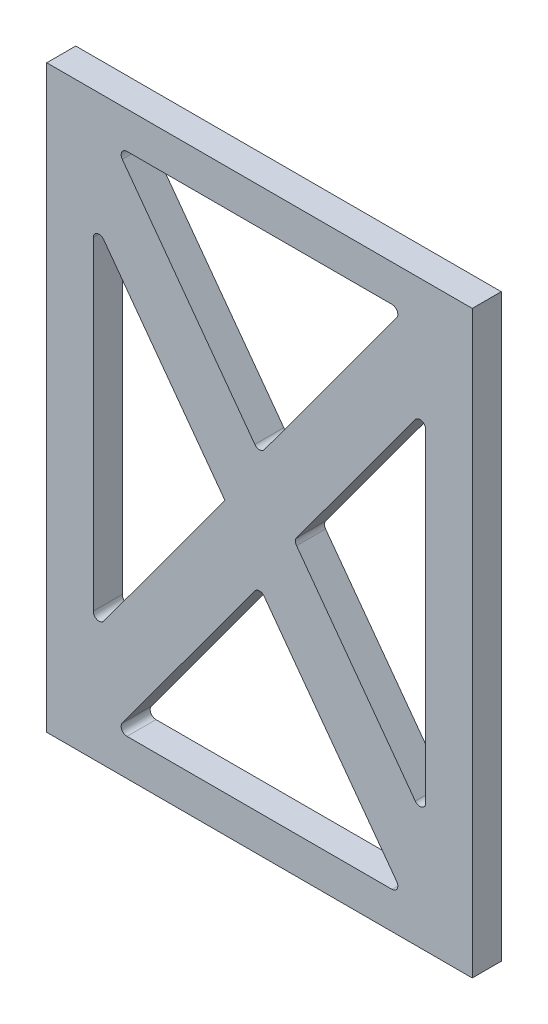
from build123d import *

# Parameters (mm, degrees)
SKETCH1_W           = 73.379310345
SKETCH1_H           = 100
BOSS_EXTRUDE1_DEPTH = 5
FILLET1_R           = 1


with BuildPart() as part:
    # Sketch1 → Boss-Extrude1 (new body)
    with BuildSketch(Plane.XY):
        with Locations((36.689655173, 50)):
            Rectangle(SKETCH1_W, SKETCH1_H)
        Polygon((8.021498376, 80.946482473), (30.729813791, 50), (8.021498376, 19.053517527), align=None, mode=Mode.SUBTRACT)
        Polygon((11.861163657, 93.680338776), (61.518146688, 93.680338776), (36.689655172, 59.844518572), align=None, mode=Mode.SUBTRACT)
        Polygon((11.861163657, 6.319661224), (61.518146688, 6.319661224), (36.689655172, 40.155481428), align=None, mode=Mode.SUBTRACT)
        Polygon((65.357811969, 80.946482473), (65.357811969, 19.053517527), (42.649496554, 50), align=None, mode=Mode.SUBTRACT)
    extrude(amount=BOSS_EXTRUDE1_DEPTH)

    # Fillet1
    fillet1_edges = [part.edges().sort_by_distance(p)[0] for p in [
        (8.021498376, 19.053517527, 2.5),
        (36.689655172, 40.155481428, 2.5),
        (61.518146688, 6.319661224, 2.5),
        (11.861163657, 6.319661224, 2.5),
        (65.357811969, 19.053517527, 2.5),
        (42.649496554, 50, 2.5),
        (65.357811969, 80.946482473, 2.5),
        (36.689655172, 59.844518572, 2.5),
        (61.518146688, 93.680338776, 2.5),
        (11.861163657, 93.680338776, 2.5),
        (8.021498376, 80.946482473, 2.5),
    ]]
    fillet(fillet1_edges, radius=FILLET1_R)


solid = part.part
